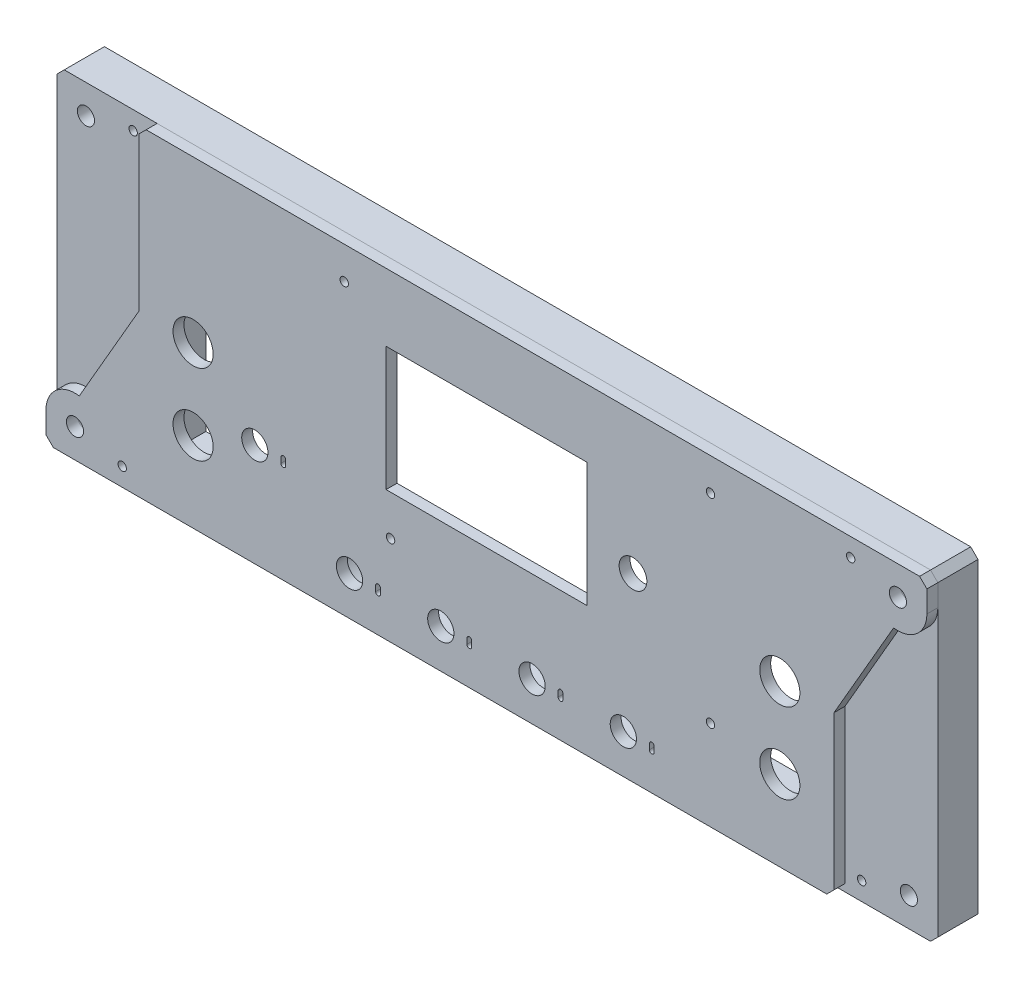
from build123d import *

# Parameters (mm, degrees)
SKETCH1_R           = 1.15
SKETCH1_R_2         = 2.35
SKETCH1_R_3         = 3.6
SKETCH1_W           = 55
SKETCH1_H           = 34
SKETCH1_R_4         = 5.5
SKETCH1_R_5         = 3.8
BOSS_EXTRUDE1_DEPTH = 3
SKETCH1_4_R         = 1.15
SKETCH1_4_R_2       = 2.35
BOSS_EXTRUDE7_DEPTH = 11


with BuildPart() as part:
    # Sketch1 → Boss-Extrude1 (new body)
    with BuildSketch(Plane.XY):
        with BuildLine():
            Line((-118.65, -44.05), (93.217720642, -44.05))
            Line((93.217720642, -44.05), (95.217720642, -42.05))
            Line((95.217720642, -42.05), (95.217720642, 0))
            Line((95.217720642, 0), (111.532377856, 28.257815203))
            ThreePointArc((111.532377856, 28.257815203), (117.891374344, 30.093609063), (120.65, 36.11))
            Line((120.65, 36.11), (120.65, 42.05))
            Line((120.65, 42.05), (118.65, 44.05))
            Line((118.65, 44.05), (-93.217720642, 44.05))
            Line((-93.217720642, 44.05), (-95.217720642, 42.05))
            Line((-95.217720642, 42.05), (-95.217720642, 0))
            Line((-95.217720642, 0), (-111.532377856, -28.257815203))
            ThreePointArc((-111.532377856, -28.257815203), (-117.891374344, -30.093609063), (-120.65, -36.11))
            Line((-120.65, -36.11), (-120.65, -42.05))
            Line((-120.65, -42.05), (-118.65, -44.05))
        make_face()
        with Locations((-99.775, -39.05)):
            Circle(SKETCH1_R, mode=Mode.SUBTRACT)
        with Locations((-112.71, -36.11)):
            Circle(SKETCH1_R_2, mode=Mode.SUBTRACT)
        with Locations((99.775, 39.05)):
            Circle(SKETCH1_R, mode=Mode.SUBTRACT)
        with Locations((112.71, 36.11)):
            Circle(SKETCH1_R_2, mode=Mode.SUBTRACT)
        with BuildLine():
            Line((44.65, -34.094646258), (44.65, -32.594646258))
            ThreePointArc((44.65, -32.594646258), (45.3, -31.944646258), (45.95, -32.594646258))
            Line((45.95, -32.594646258), (45.95, -34.094646258))
            ThreePointArc((45.95, -34.094646258), (45.3, -34.744646258), (44.65, -34.094646258))
        make_face(mode=Mode.SUBTRACT)
        with BuildLine():
            ThreePointArc((19.65, -32.594646258), (20.3, -31.944646258), (20.95, -32.594646258))
            Line((20.95, -32.594646258), (20.95, -34.094646258))
            ThreePointArc((20.95, -34.094646258), (20.3, -34.744646258), (19.65, -34.094646258))
            Line((19.65, -34.094646258), (19.65, -32.594646258))
        make_face(mode=Mode.SUBTRACT)
        with Locations((37.5, -33.344646258)):
            Circle(SKETCH1_R_3, mode=Mode.SUBTRACT)
        with Locations((-37.5, -33.344646258)):
            Circle(SKETCH1_R_3, mode=Mode.SUBTRACT)
        with BuildLine():
            ThreePointArc((-30.35, -32.594646258), (-29.7, -31.944646258), (-29.05, -32.594646258))
            Line((-29.05, -32.594646258), (-29.05, -34.094646258))
            ThreePointArc((-29.05, -34.094646258), (-29.7, -34.744646258), (-30.35, -34.094646258))
            Line((-30.35, -34.094646258), (-30.35, -32.594646258))
        make_face(mode=Mode.SUBTRACT)
        with Locations((-12.5, -33.344646258)):
            Circle(SKETCH1_R_3, mode=Mode.SUBTRACT)
        with BuildLine():
            Line((-5.35, -34.094646258), (-5.35, -32.594646258))
            ThreePointArc((-5.35, -32.594646258), (-4.7, -31.944646258), (-4.05, -32.594646258))
            Line((-4.05, -32.594646258), (-4.05, -34.094646258))
            ThreePointArc((-4.05, -34.094646258), (-4.7, -34.744646258), (-5.35, -34.094646258))
        make_face(mode=Mode.SUBTRACT)
        with Locations((12.5, -33.344646258)):
            Circle(SKETCH1_R_3, mode=Mode.SUBTRACT)
        with Locations((0, 8.55)):
            Rectangle(SKETCH1_W, SKETCH1_H, mode=Mode.SUBTRACT)
        with Locations((61.372585267, 35.150707483)):
            Circle(SKETCH1_R, mode=Mode.SUBTRACT)
        with Locations((-26.257414733, -19.459292517)):
            Circle(SKETCH1_R, mode=Mode.SUBTRACT)
        with Locations((61.372585267, -19.459292517)):
            Circle(SKETCH1_R, mode=Mode.SUBTRACT)
        with Locations((-38.957414733, 35.150707483)):
            Circle(SKETCH1_R, mode=Mode.SUBTRACT)
        with Locations((80.358860321, 0)):
            Circle(SKETCH1_R_4, mode=Mode.SUBTRACT)
        with Locations((80.358860321, -22.025)):
            Circle(SKETCH1_R_4, mode=Mode.SUBTRACT)
        with Locations((-80.357720642, -22.025)):
            Circle(SKETCH1_R_4, mode=Mode.SUBTRACT)
        with BuildLine():
            Line((-54.993253468, -15.11863742), (-54.993253468, -16.61863742))
            ThreePointArc((-54.993253468, -16.61863742), (-55.643253468, -17.26863742), (-56.293253468, -16.61863742))
            Line((-56.293253468, -16.61863742), (-56.293253468, -15.11863742))
            ThreePointArc((-56.293253468, -15.11863742), (-55.643253468, -14.46863742), (-54.993253468, -15.11863742))
        make_face(mode=Mode.SUBTRACT)
        with Locations((-63.443253468, -15.86863742)):
            Circle(SKETCH1_R_3, mode=Mode.SUBTRACT)
        with Locations((-80.357720642, 0)):
            Circle(SKETCH1_R_4, mode=Mode.SUBTRACT)
        with Locations((40.137585267, 5.460707483)):
            Circle(SKETCH1_R_5, mode=Mode.SUBTRACT)
    extrude(amount=BOSS_EXTRUDE1_DEPTH)


with BuildPart() as body_2:
    # Sketch1<4> → Boss-Extrude7 (new body)
    with BuildSketch(Plane.XY):
        Polygon((-118.65, -44.05), (118.65, -44.05), (120.65, -42.05), (120.65, 42.05), (118.65, 44.05), (-118.65, 44.05), (-120.65, 42.05), (-120.65, -42.05), align=None)
        with Locations((-99.775, -39.05)):
            Circle(SKETCH1_4_R, mode=Mode.SUBTRACT)
        with Locations((-112.71, -36.11)):
            Circle(SKETCH1_4_R_2, mode=Mode.SUBTRACT)
        with BuildLine():
            Line((93.858860321, 10.001847162), (93.858860321, 0))
            Line((93.858860321, 0), (93.858860321, -33.344646258))
            Line((93.858860321, -33.344646258), (46, -33.344646258))
            ThreePointArc((46, -33.344646258), (43.51040764, -39.355053898), (37.5, -41.844646258))
            Line((37.5, -41.844646258), (-37.5, -41.844646258))
            ThreePointArc((-37.5, -41.844646258), (-43.51040764, -39.355053898), (-46, -33.344646258))
            Line((-46, -33.344646258), (-90.857720642, -33.344646258))
            Line((-90.857720642, -33.344646258), (-90.857720642, 38.360707483))
            Line((-90.857720642, 38.360707483), (65.5, 38.360707483))
            Line((65.5, 38.360707483), (93.858860321, 10.001847162))
        make_face(mode=Mode.SUBTRACT)
        with Locations((112.71, 36.11)):
            Circle(SKETCH1_4_R_2, mode=Mode.SUBTRACT)
        with Locations((99.775, 39.05)):
            Circle(SKETCH1_4_R, mode=Mode.SUBTRACT)
        with Locations((-112.71, 36.11)):
            Circle(SKETCH1_4_R_2, mode=Mode.SUBTRACT)
        with Locations((-99.775, 39.05)):
            Circle(SKETCH1_4_R, mode=Mode.SUBTRACT)
        with Locations((99.775, -39.05)):
            Circle(SKETCH1_4_R, mode=Mode.SUBTRACT)
        with Locations((112.71, -36.11)):
            Circle(SKETCH1_4_R_2, mode=Mode.SUBTRACT)
    extrude(amount=-BOSS_EXTRUDE7_DEPTH)


solid = Compound([part.part, body_2.part])
